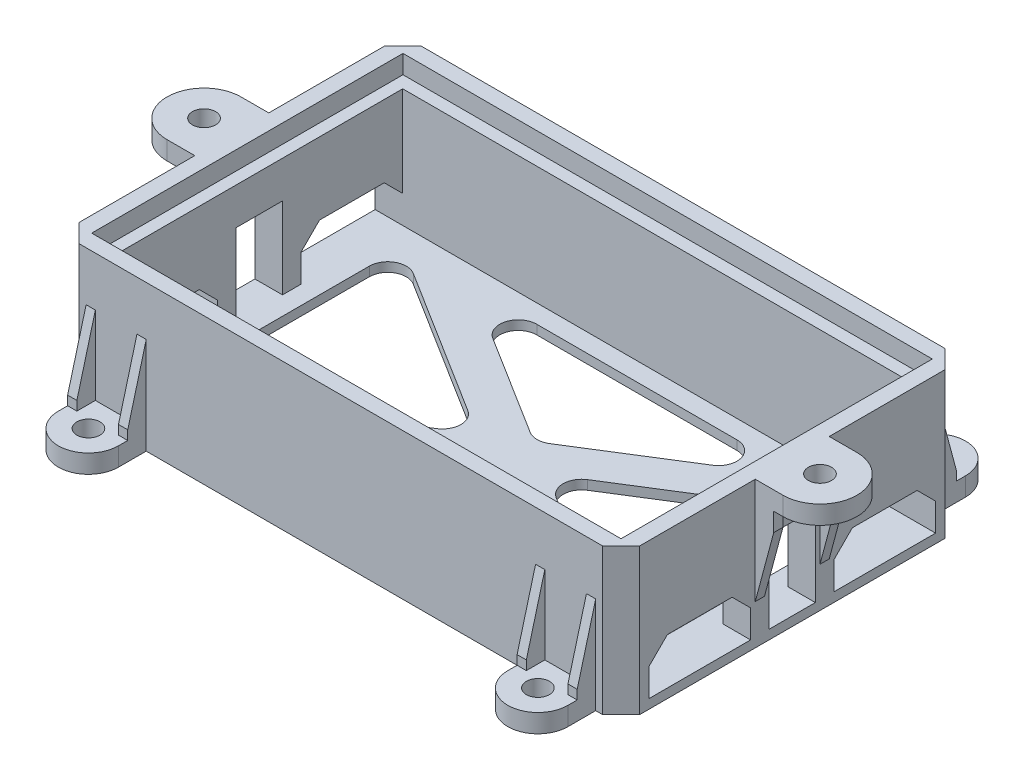
from build123d import *
from OCP.BRepFilletAPI import BRepFilletAPI_MakeChamfer

# Parameters (mm, degrees)
SKETCH1_W           = 76.962
SKETCH1_H           = 46.99
BOSS_EXTRUDE1_DEPTH = 20.066
SKETCH2_W           = 72.68972
SKETCH2_H           = 42.7482
CUT_EXTRUDE1_DEPTH  = 2.54
SKETCH3_W           = 69.38772
SKETCH3_H           = 39.37
CUT_EXTRUDE2_DEPTH  = 16.256
CHAMFER1_SIZE       = 2.54
SKETCH6_R           = 1.5875
BOSS_EXTRUDE2_DEPTH = 2.54
CUT_EXTRUDE5_DEPTH  = 97.402641646
FILLET1_R           = 2.54
SKETCH9_R           = 1.5875
BOSS_EXTRUDE3_DEPTH = 2.54
SKETCH12_W          = 1.27
SKETCH12_H          = 2.54
BOSS_EXTRUDE5_DEPTH = 1.27
CHAMFER4_SIZE       = 2.54
CHAMFER4_SIZE_2     = 9.479409052
SKETCH13_W          = 6.35
SKETCH13_H          = 11.176
SKETCH13_W_2        = 13.97
SKETCH13_H_2        = 6.35
CUT_EXTRUDE7_DEPTH  = 104.876082503
SKETCH14_W          = 2.54
SKETCH14_H          = 1.27
BOSS_EXTRUDE6_DEPTH = 2.54
CHAMFER5_SIZE       = 2.54000495
CHAMFER5_SIZE_2     = 9.479427523
CHAMFER6_SIZE       = 2.54


with BuildPart() as part:
    # Sketch1 → Boss-Extrude1 (new body)
    with BuildSketch(Plane(origin=(0, 0, 0), x_dir=(1, 0, 0), z_dir=(0, 1, 0))):
        with Locations((38.481, 23.495)):
            Rectangle(SKETCH1_W, SKETCH1_H)
    extrude(amount=BOSS_EXTRUDE1_DEPTH)

    # Sketch2 → Cut-Extrude1 (cut)
    with BuildSketch(Plane(origin=(0, 20.066, 0), x_dir=(1, 0, 0), z_dir=(0, 1, 0))):
        with Locations((38.481, 23.495)):
            Rectangle(SKETCH2_W, SKETCH2_H)
    extrude(amount=-CUT_EXTRUDE1_DEPTH, mode=Mode.SUBTRACT)

    # Sketch3 → Cut-Extrude2 (cut)
    with BuildSketch(Plane(origin=(0, 17.526, 0), x_dir=(1, 0, 0), z_dir=(0, 1, 0))):
        with Locations((38.481, 23.495)):
            Rectangle(SKETCH3_W, SKETCH3_H)
    extrude(amount=-CUT_EXTRUDE2_DEPTH, mode=Mode.SUBTRACT)

    # Chamfer1
    chamfer1_edges = [part.edges().sort_by_distance(p)[0] for p in [
        (0, 10.033, -46.99),
        (76.962, 10.033, -46.99),
        (76.962, 10.033, 0),
        (0, 10.033, 0),
    ]]
    chamfer(chamfer1_edges, length=CHAMFER1_SIZE)

    # Sketch6 → Boss-Extrude2 (add)
    # profile 1 of 4: a face of its own
    with BuildSketch(Plane.XZ):
        with BuildLine():
            Line((3.4925, 3.81), (3.4925, 0))
            Line((3.4925, 0), (11.7475, 0))
            Line((11.7475, 0), (11.7475, 3.81))
            ThreePointArc((11.7475, 3.81), (7.62, 7.9375), (3.4925, 3.81))
        make_face()
        with Locations(Location((7.62, 3.81, 0), (0, 0, 270))):
            Circle(SKETCH6_R, mode=Mode.SUBTRACT)
    # profile 2 of 4: a face of its own
    with BuildSketch(Plane.XZ):
        with BuildLine():
            Line((11.7475, -46.99), (11.7475, -50.8))
            ThreePointArc((11.7475, -50.8), (7.62, -54.9275), (3.4925, -50.8))
            Line((3.4925, -50.8), (3.4925, -46.99))
            Line((3.4925, -46.99), (11.7475, -46.99))
        make_face()
        with Locations(Location((7.62, -50.8, 0), (0, 0, 90))):
            Circle(SKETCH6_R, mode=Mode.SUBTRACT)
    # profile 3 of 4: a face of its own
    with BuildSketch(Plane.XZ):
        with BuildLine():
            Line((73.4695, -50.8), (73.4695, -46.99))
            Line((73.4695, -46.99), (65.2145, -46.99))
            Line((65.2145, -46.99), (65.2145, -50.8))
            ThreePointArc((65.2145, -50.8), (69.342, -54.9275), (73.4695, -50.8))
        make_face()
        with Locations(Location((69.342, -50.8, 0), (0, 0, 270))):
            Circle(SKETCH6_R, mode=Mode.SUBTRACT)
    # profile 4 of 4: a face of its own
    with BuildSketch(Plane.XZ):
        with BuildLine():
            Line((65.2145, 0), (65.2145, 3.81))
            ThreePointArc((65.2145, 3.81), (69.342, 7.9375), (73.4695, 3.81))
            Line((73.4695, 3.81), (73.4695, 0))
            Line((73.4695, 0), (65.2145, 0))
        make_face()
        with Locations(Location((69.342, 3.81, 0), (0, 0, 90))):
            Circle(SKETCH6_R, mode=Mode.SUBTRACT)
    extrude(amount=-BOSS_EXTRUDE2_DEPTH)

    # Sketch7 → Cut-Extrude5 (cut, through all)
    with BuildSketch(Plane(origin=(0, 1.27, 0), x_dir=(1, 0, 0), z_dir=(0, 1, 0))):
        Polygon((15.896309728, 40.64), (61.065690272, 40.64), (38.481, 26.492218855), align=None)
        Polygon((6.32714, 40.64), (6.32714, 6.35), (33.696415136, 23.495), align=None)
        Polygon((15.964259965, 6.392566228), (60.997740035, 6.392566228), (38.481, 20.497781145), align=None)
        Polygon((70.63486, 40.64), (70.63486, 6.35), (43.265584864, 23.495), align=None)
    extrude(amount=-CUT_EXTRUDE5_DEPTH, mode=Mode.SUBTRACT)

    # Fillet1
    fillet1_edges = [part.edges().sort_by_distance(p)[0] for p in [
        (61.065690272, 0.635, -40.64),
        (38.481, 0.635, -26.492218855),
        (15.896309728, 0.635, -40.64),
        (15.964259965, 0.635, -6.392566228),
        (38.481, 0.635, -20.497781145),
        (60.997740035, 0.635, -6.392566228),
        (43.265584864, 0.635, -23.495),
        (70.63486, 0.635, -40.64),
        (70.63486, 0.635, -6.35),
        (33.696415136, 0.635, -23.495),
        (6.32714, 0.635, -6.35),
        (6.32714, 0.635, -40.64),
    ]]
    fillet(fillet1_edges, radius=FILLET1_R)

    # Sketch9 → Boss-Extrude3 (add)
    # profile 1 of 2: a face of its own
    with BuildSketch(Plane(origin=(0, 20.066, 0), x_dir=(1, 0, 0), z_dir=(0, 1, 0))):
        with BuildLine():
            Line((-3.81, 28.575), (0, 28.575))
            Line((0, 28.575), (0, 18.415))
            Line((0, 18.415), (-3.81, 18.415))
            ThreePointArc((-3.81, 18.415), (-8.89, 23.495), (-3.81, 28.575))
        make_face()
        with Locations(Location((-3.81, 23.495, 0), (0, 0, 270))):
            Circle(SKETCH9_R, mode=Mode.SUBTRACT)
    # profile 2 of 2: a face of its own
    with BuildSketch(Plane(origin=(0, 20.066, 0), x_dir=(1, 0, 0), z_dir=(0, 1, 0))):
        with BuildLine():
            Line((76.962, 18.415), (80.772, 18.415))
            ThreePointArc((80.772, 18.415), (85.852, 23.495), (80.772, 28.575))
            Line((80.772, 28.575), (76.962, 28.575))
            Line((76.962, 28.575), (76.962, 18.415))
        make_face()
        with Locations(Location((80.772, 23.495, 0), (0, 0, 90))):
            Circle(SKETCH9_R, mode=Mode.SUBTRACT)
    extrude(amount=-BOSS_EXTRUDE3_DEPTH)

    # Sketch12 → Boss-Extrude5 (add)
    with BuildSketch(Plane(origin=(0, 2.54, 0), x_dir=(1, 0, 0), z_dir=(0, 1, 0))):
        with Locations((4.1275, -1.27)):
            Rectangle(SKETCH12_W, SKETCH12_H)
        with Locations((11.1125, -1.27)):
            Rectangle(SKETCH12_W, SKETCH12_H)
        with Locations((11.1125, 48.26)):
            Rectangle(SKETCH12_W, SKETCH12_H)
        with Locations((4.1275, 48.26)):
            Rectangle(SKETCH12_W, SKETCH12_H)
        with Locations((72.8345, 48.26)):
            Rectangle(SKETCH12_W, SKETCH12_H)
        with Locations((65.8495, 48.26)):
            Rectangle(SKETCH12_W, SKETCH12_H)
        with Locations((65.8495, -1.27)):
            Rectangle(SKETCH12_W, SKETCH12_H)
        with Locations((72.8345, -1.27)):
            Rectangle(SKETCH12_W, SKETCH12_H)
    extrude(amount=BOSS_EXTRUDE5_DEPTH)

    # Chamfer4
    chamfer4_edges_1 = [part.edges().sort_by_distance(p)[0] for p in [
        (4.1275, 3.81, -46.99),
    ]]
    chamfer4_side_1 = [part.faces().sort_by_distance(p)[0] for p in [
        (4.1275, 3.81, -47.0408),
    ]]
    chamfer4_edges_2 = [part.edges().sort_by_distance(p)[0] for p in [
        (11.1125, 3.81, -46.99),
    ]]
    chamfer4_side_2 = [part.faces().sort_by_distance(p)[0] for p in [
        (11.1125, 3.81, -47.0408),
    ]]
    chamfer4_edges_3 = [part.edges().sort_by_distance(p)[0] for p in [
        (65.8495, 3.81, -46.99),
    ]]
    chamfer4_side_3 = [part.faces().sort_by_distance(p)[0] for p in [
        (65.8495, 3.81, -47.0408),
    ]]
    chamfer4_edges_4 = [part.edges().sort_by_distance(p)[0] for p in [
        (72.8345, 3.81, -46.99),
    ]]
    chamfer4_side_4 = [part.faces().sort_by_distance(p)[0] for p in [
        (72.8345, 3.81, -47.0408),
    ]]
    chamfer4_edges_5 = [part.edges().sort_by_distance(p)[0] for p in [
        (65.8495, 3.81, 0),
    ]]
    chamfer4_side_5 = [part.faces().sort_by_distance(p)[0] for p in [
        (65.8495, 3.81, 0.0508),
    ]]
    chamfer4_edges_6 = [part.edges().sort_by_distance(p)[0] for p in [
        (72.8345, 3.81, 0),
    ]]
    chamfer4_side_6 = [part.faces().sort_by_distance(p)[0] for p in [
        (72.8345, 3.81, 0.0508),
    ]]
    chamfer4_edges_7 = [part.edges().sort_by_distance(p)[0] for p in [
        (11.1125, 3.81, 0),
    ]]
    chamfer4_side_7 = [part.faces().sort_by_distance(p)[0] for p in [
        (11.1125, 3.81, 0.0508),
    ]]
    chamfer4_edges_8 = [part.edges().sort_by_distance(p)[0] for p in [
        (4.1275, 3.81, 0),
    ]]
    chamfer4_side_8 = [part.faces().sort_by_distance(p)[0] for p in [
        (4.1275, 3.81, 0.0508),
    ]]
    chamfer4 = BRepFilletAPI_MakeChamfer(part.part.solid().wrapped)
    for e in chamfer4_edges_1:
        chamfer4.Add(CHAMFER4_SIZE - 0.0001, CHAMFER4_SIZE_2 - 0.0001, e.wrapped, chamfer4_side_1[0].wrapped)
    for e in chamfer4_edges_2:
        chamfer4.Add(CHAMFER4_SIZE - 0.0001, CHAMFER4_SIZE_2 - 0.0001, e.wrapped, chamfer4_side_2[0].wrapped)
    for e in chamfer4_edges_3:
        chamfer4.Add(CHAMFER4_SIZE - 0.0001, CHAMFER4_SIZE_2 - 0.0001, e.wrapped, chamfer4_side_3[0].wrapped)
    for e in chamfer4_edges_4:
        chamfer4.Add(CHAMFER4_SIZE - 0.0001, CHAMFER4_SIZE_2 - 0.0001, e.wrapped, chamfer4_side_4[0].wrapped)
    for e in chamfer4_edges_5:
        chamfer4.Add(CHAMFER4_SIZE - 0.0001, CHAMFER4_SIZE_2 - 0.0001, e.wrapped, chamfer4_side_5[0].wrapped)
    for e in chamfer4_edges_6:
        chamfer4.Add(CHAMFER4_SIZE - 0.0001, CHAMFER4_SIZE_2 - 0.0001, e.wrapped, chamfer4_side_6[0].wrapped)
    for e in chamfer4_edges_7:
        chamfer4.Add(CHAMFER4_SIZE - 0.0001, CHAMFER4_SIZE_2 - 0.0001, e.wrapped, chamfer4_side_7[0].wrapped)
    for e in chamfer4_edges_8:
        chamfer4.Add(CHAMFER4_SIZE - 0.0001, CHAMFER4_SIZE_2 - 0.0001, e.wrapped, chamfer4_side_8[0].wrapped)
    add(Compound.cast(chamfer4.Shape()), mode=Mode.REPLACE)  # a hair under: the kernel refuses the full size

    # Sketch13 → Cut-Extrude7 (cut, through all)
    with BuildSketch(Plane.ZY):
        with Locations((-23.495, 6.858)):
            Rectangle(SKETCH13_W, SKETCH13_H)
        with Locations((-36.195, 4.445)):
            Rectangle(SKETCH13_W_2, SKETCH13_H_2)
        with Locations((-10.795, 4.445)):
            Rectangle(SKETCH13_W_2, SKETCH13_H_2)
    extrude(amount=-CUT_EXTRUDE7_DEPTH, mode=Mode.SUBTRACT)

    # Sketch14 → Boss-Extrude6 (add)
    with BuildSketch(Plane.XZ.offset(-17.526)):
        with Locations((-1.27, -19.05)):
            Rectangle(SKETCH14_W, SKETCH14_H)
        with Locations((-1.27, -27.94)):
            Rectangle(SKETCH14_W, SKETCH14_H)
        with Locations((78.232, -27.94)):
            Rectangle(SKETCH14_W, SKETCH14_H)
        with Locations((78.232, -19.05)):
            Rectangle(SKETCH14_W, SKETCH14_H)
    extrude(amount=BOSS_EXTRUDE6_DEPTH)

    # Chamfer5
    chamfer5_edges_1 = [part.edges().sort_by_distance(p)[0] for p in [
        (76.962, 14.986, -19.05),
    ]]
    chamfer5_side_1 = [part.faces().sort_by_distance(p)[0] for p in [
        (77.012800099, 14.986, -19.05),
    ]]
    chamfer5_edges_2 = [part.edges().sort_by_distance(p)[0] for p in [
        (76.962, 14.986, -27.94),
    ]]
    chamfer5_side_2 = [part.faces().sort_by_distance(p)[0] for p in [
        (77.012800099, 14.986, -27.94),
    ]]
    chamfer5_edges_3 = [part.edges().sort_by_distance(p)[0] for p in [
        (0, 14.986, -27.94),
    ]]
    chamfer5_side_3 = [part.faces().sort_by_distance(p)[0] for p in [
        (-0.050800099, 14.986, -27.94),
    ]]
    chamfer5_edges_4 = [part.edges().sort_by_distance(p)[0] for p in [
        (0, 14.986, -19.05),
    ]]
    chamfer5_side_4 = [part.faces().sort_by_distance(p)[0] for p in [
        (-0.050800099, 14.986, -19.05),
    ]]
    chamfer5 = BRepFilletAPI_MakeChamfer(part.part.solid().wrapped)
    for e in chamfer5_edges_1:
        chamfer5.Add(CHAMFER5_SIZE - 0.0001, CHAMFER5_SIZE_2 - 0.0001, e.wrapped, chamfer5_side_1[0].wrapped)
    for e in chamfer5_edges_2:
        chamfer5.Add(CHAMFER5_SIZE - 0.0001, CHAMFER5_SIZE_2 - 0.0001, e.wrapped, chamfer5_side_2[0].wrapped)
    for e in chamfer5_edges_3:
        chamfer5.Add(CHAMFER5_SIZE - 0.0001, CHAMFER5_SIZE_2 - 0.0001, e.wrapped, chamfer5_side_3[0].wrapped)
    for e in chamfer5_edges_4:
        chamfer5.Add(CHAMFER5_SIZE - 0.0001, CHAMFER5_SIZE_2 - 0.0001, e.wrapped, chamfer5_side_4[0].wrapped)
    add(Compound.cast(chamfer5.Shape()), mode=Mode.REPLACE)  # a hair under: the kernel refuses the full size

    # Chamfer6
    chamfer6_edges = [part.edges().sort_by_distance(p)[0] for p in [
        (75.06843, 7.62, -43.18),
        (1.89357, 7.62, -43.18),
        (75.06843, 7.62, -29.21),
        (1.89357, 7.62, -29.21),
        (75.06843, 7.62, -17.78),
        (1.89357, 7.62, -17.78),
        (75.06843, 7.62, -3.81),
        (1.89357, 7.62, -3.81),
    ]]
    chamfer(chamfer6_edges, length=CHAMFER6_SIZE)


solid = part.part
